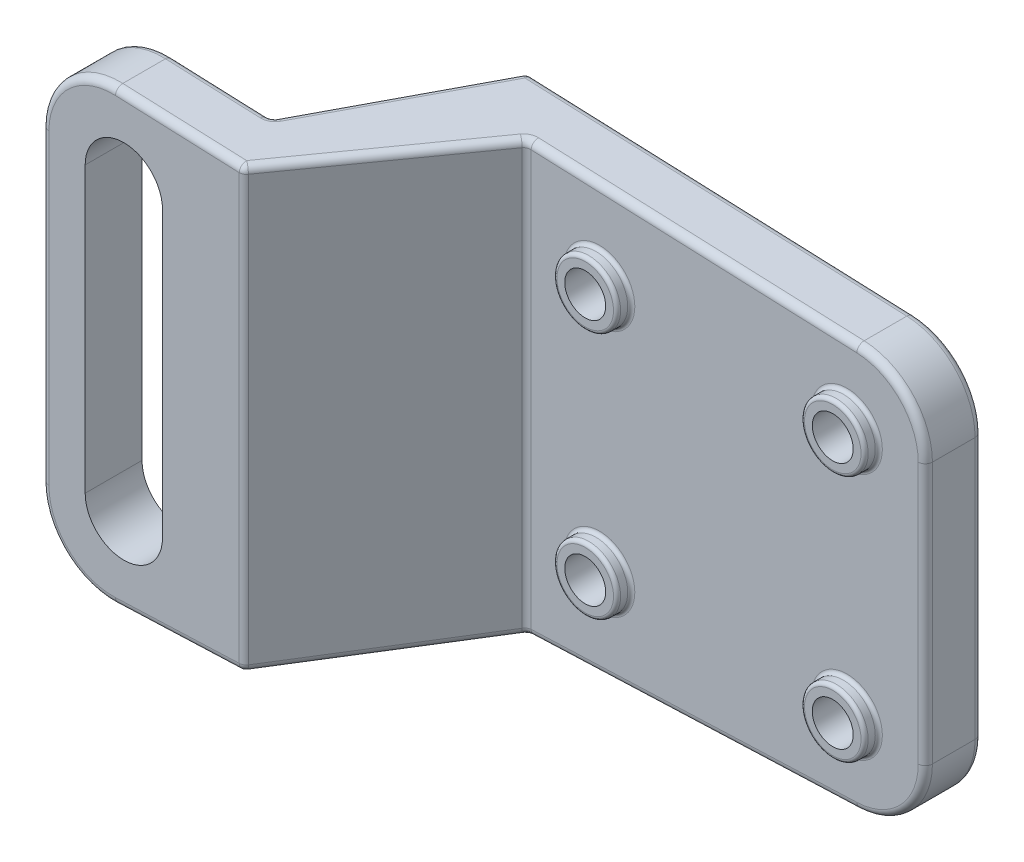
from build123d import *

# Parameters (mm, degrees)
SKETCH1_R           = 1.905
SKETCH1_R_2         = 1.9050000000000002
SKETCH1_R_3         = 1.9049999999999998
BOSS_EXTRUDE1_DEPTH = 3.175
FILLET1_R           = 3.96875
BOSS_EXTRUDE2_START = -1.5875
SKETCH2_R           = 1.9049999999999998
SKETCH2_R_2         = 1.143
SKETCH2_R_3         = 1.905
SKETCH2_R_4         = 1.1430000000000005
SKETCH2_R_5         = 1.9050000000000002
SKETCH2_R_6         = 1.1430000000000007
BOSS_EXTRUDE2_DEPTH = 1.5875
SKETCH4_R           = 1.778
SKETCH4_R_2         = 1.143
SKETCH4_R_3         = 1.7779999999999996
SKETCH4_R_4         = 1.1430000000000007
SKETCH4_R_5         = 1.1430000000000005
SKETCH4_R_6         = 1.1429999999999998
BOSS_EXTRUDE3_DEPTH = 0.79375
BOSS_EXTRUDE4_DEPTH = 9.525
CUT_EXTRUDE1_START  = 9.525
CUT_EXTRUDE1_DEPTH  = 9.525
CHAMFER1_SIZE       = 4.7625
CHAMFER1_SIZE_2     = 9.525
CHAMFER2_SIZE       = 9.525
CHAMFER2_SIZE_2     = 6.35
FILLET2_R           = 0.1984375
FILLET3_R           = 0.396875


with BuildPart() as part:
    # Sketch1 → Boss-Extrude1 (new body)
    with BuildSketch(Plane.XY):
        Polygon((-21.61209534413694, 5.788533000000001), (18.198446569224675, 4.201032999999999), (18.198446569224675, -18.023967), (-21.61209534413694, -19.611466999999998), align=None)
        Circle(SKETCH1_R, mode=Mode.SUBTRACT)
        with Locations((13.822933999999998, 0)):
            Circle(SKETCH1_R_2, mode=Mode.SUBTRACT)
        with Locations((13.822933999999998, -13.822933999999995)):
            Circle(SKETCH1_R, mode=Mode.SUBTRACT)
        with Locations((0, -13.822933999999998)):
            Circle(SKETCH1_R_3, mode=Mode.SUBTRACT)
        with BuildLine():
            Line((-14.873224000000008, 1.0260330000000009), (-14.873224000000008, -14.848967))
            ThreePointArc((-14.873224000000008, -14.848967), (-17.032224000000006, -17.007966999999994), (-19.191224000000002, -14.848967))
            Line((-19.191224000000002, -14.848967), (-19.191224000000002, 1.0260330000000009))
            ThreePointArc((-19.191224000000002, 1.0260330000000009), (-17.032224000000003, 3.1850329999999962), (-14.873224000000008, 1.0260330000000009))
        make_face(mode=Mode.SUBTRACT)
    extrude(amount=BOSS_EXTRUDE1_DEPTH)

    # Fillet1
    fillet1_edges = [part.edges().sort_by_distance(p)[0] for p in [
        (18.198446569224675, -18.023967, 1.5875),
        (-21.61209534413694, -19.611466999999998, 1.5875),
        (-21.61209534413694, 5.788533000000001, 1.5875),
        (18.198446569224675, 4.201032999999999, 1.5875),
    ]]
    fillet(fillet1_edges, radius=FILLET1_R)

    # Sketch2 → Boss-Extrude2 (add)
    # profile 1 of 4: a face of its own
    with BuildSketch(Plane.XY.offset(3.175).offset(BOSS_EXTRUDE2_START)):
        with Locations((0, -13.822933999999998)):
            Circle(SKETCH2_R)
        with Locations((0, -13.822933999999998)):
            Circle(SKETCH2_R_2, mode=Mode.SUBTRACT)
    # profile 2 of 4: a face of its own
    with BuildSketch(Plane.XY.offset(3.175).offset(BOSS_EXTRUDE2_START)):
        with Locations((13.822933999999998, -13.822933999999995)):
            Circle(SKETCH2_R_3)
        with Locations((13.822933999999998, -13.822933999999995)):
            Circle(SKETCH2_R_4, mode=Mode.SUBTRACT)
    # profile 3 of 4: a face of its own
    with BuildSketch(Plane.XY.offset(3.175).offset(BOSS_EXTRUDE2_START)):
        with Locations((13.822933999999998, 0)):
            Circle(SKETCH2_R_5)
        with Locations((13.822933999999998, 0)):
            Circle(SKETCH2_R_6, mode=Mode.SUBTRACT)
    # profile 4 of 4: a face of its own
    with BuildSketch(Plane.XY.offset(3.175).offset(BOSS_EXTRUDE2_START)):
        Circle(SKETCH2_R_3)
        Circle(SKETCH2_R_2, mode=Mode.SUBTRACT)
    extrude(amount=BOSS_EXTRUDE2_DEPTH)

    # Sketch4 → Boss-Extrude3 (add)
    # profile 1 of 4: a face of its own
    with BuildSketch(Plane.XY.offset(3.175)):
        Circle(SKETCH4_R)
        Circle(SKETCH4_R_2, mode=Mode.SUBTRACT)
    # profile 2 of 4: a face of its own
    with BuildSketch(Plane.XY.offset(3.175)):
        with Locations((13.822933999999998, 0)):
            Circle(SKETCH4_R_3)
        with Locations((13.822933999999998, 0)):
            Circle(SKETCH4_R_4, mode=Mode.SUBTRACT)
    # profile 3 of 4: a face of its own
    with BuildSketch(Plane.XY.offset(3.175)):
        with Locations((13.822933999999998, -13.822933999999995)):
            Circle(SKETCH4_R_3)
        with Locations((13.822933999999998, -13.822933999999995)):
            Circle(SKETCH4_R_5, mode=Mode.SUBTRACT)
    # profile 4 of 4: a face of its own
    with BuildSketch(Plane.XY.offset(3.175)):
        with Locations((0, -13.822933999999998)):
            Circle(SKETCH4_R)
        with Locations((0, -13.822933999999998)):
            Circle(SKETCH4_R_6, mode=Mode.SUBTRACT)
    extrude(amount=BOSS_EXTRUDE3_DEPTH)

    # Sketch5 → Boss-Extrude4 (add)
    with BuildSketch(Plane(origin=(0, 0, 3.175), x_dir=(-1, 0, 0), z_dir=(0, 0, -1))):
        with BuildLine():
            Line((4.026553430775324, 5.087285379502482), (4.026553430775327, -18.91021937950248))
            Line((4.026553430775327, -18.91021937950248), (17.485211666877564, -19.44690184909331))
            ThreePointArc((17.485211666877564, -19.44690184909331), (20.39319838847193, -18.342996140881855), (21.61209534413694, -15.48130349542505))
            Line((21.61209534413694, -15.48130349542505), (21.61209534413694, 1.658369495425054))
            ThreePointArc((21.61209534413694, 1.658369495425054), (20.393198388471934, 4.520062140881859), (17.485211666877564, 5.623967849093316))
            Line((17.485211666877564, 5.623967849093316), (4.026553430775324, 5.087285379502482))
        make_face()
        with BuildLine():
            Line((19.191224000000002, 1.0260330000000009), (19.191224000000002, -14.848967))
            ThreePointArc((19.191224000000002, -14.848967), (17.032224000000006, -17.007967), (14.873224000000008, -14.848967))
            Line((14.873224000000008, -14.848967), (14.873224000000008, 1.0260330000000009))
            ThreePointArc((14.873224000000008, 1.0260330000000009), (17.032224000000003, 3.185033), (19.191224000000002, 1.0260330000000009))
        make_face(mode=Mode.SUBTRACT)
    extrude(amount=-BOSS_EXTRUDE4_DEPTH)

    # Sketch6 → Cut-Extrude1 (cut)
    with BuildSketch(Plane.XY.offset(CUT_EXTRUDE1_START)):
        with BuildLine():
            Line((-7.201553430775324, 5.213892862288551), (-7.201553430775321, -19.036826862288546))
            Line((-7.201553430775321, -19.036826862288546), (-17.485211666877564, -19.44690184909331))
            ThreePointArc((-17.485211666877564, -19.44690184909331), (-20.393198388471934, -18.342996140881855), (-21.61209534413694, -15.48130349542505))
            Line((-21.61209534413694, -15.48130349542505), (-21.61209534413694, 1.658369495425054))
            ThreePointArc((-21.61209534413694, 1.658369495425054), (-20.393198388471934, 4.520062140881859), (-17.485211666877564, 5.623967849093316))
            Line((-17.485211666877564, 5.623967849093316), (-7.201553430775324, 5.213892862288551))
        make_face()
    extrude(amount=-CUT_EXTRUDE1_DEPTH, mode=Mode.SUBTRACT)

    # Chamfer1
    # the kernel refuses this chamfer: 9.525, 4.7625 mm, written as the material it adds along each edge
    with BuildSketch(Plane(origin=(-7.201553430775328, 29.882012885108104, 9.525), x_dir=(-0.9976223042390325, 0, 0.06891834360170876), z_dir=(1.5e-16, -1, 0))) as chamfer1_piece_1_section:
        Polygon((CHAMFER1_SIZE * 0.997622304239, CHAMFER1_SIZE * 0.0689183436017), (-CHAMFER1_SIZE_2 * 0.0689183436017, CHAMFER1_SIZE_2 * 0.997622304239), (0, 0), align=None)
    chamfer1_piece_1 = extrude(amount=73.5869597702162, mode=Mode.PRIVATE)
    chamfer1_piece_1 = split(chamfer1_piece_1, bisect_by=Plane(origin=(-8.238125396865149, 5.255227592163586, 6.340615679187515), z_dir=(-0.03984470608110253, -0.9992058843888534, 0)), keep=Keep.TOP, mode=Mode.PRIVATE)
    chamfer1_piece_1 = split(chamfer1_piece_1, bisect_by=Plane(origin=(-8.723289042893713, -6.911466999999917, 0), z_dir=(0, 0, 1)), keep=Keep.TOP, mode=Mode.PRIVATE)
    chamfer1_piece_1 = split(chamfer1_piece_1, bisect_by=Plane(origin=(-8.238125396865144, -19.078161592163585, 6.340615679187515), z_dir=(-0.039844706081102445, 0.9992058843888534, 0)), keep=Keep.TOP, mode=Mode.PRIVATE)
    add(chamfer1_piece_1)

    # Chamfer2
    # the kernel refuses this chamfer: 9.525, 6.35 mm, written as the material it takes off along each edge
    with BuildSketch(Plane(origin=(-4.02655343077532, 29.697985369397475, 12.7), x_dir=(0.021468383147227387, 0, -0.9997695277037822), z_dir=(-1.5e-16, -1, 0))) as chamfer2_piece_1_section:
        Polygon((CHAMFER2_SIZE * 0.999769527704, -CHAMFER2_SIZE * 0.0214683831472), (-CHAMFER2_SIZE_2 * 0.0214683831472, -CHAMFER2_SIZE_2 * 0.999769527704), (0, 0), align=None)
    chamfer2_piece_1 = extrude(amount=73.21890473879495, mode=Mode.PRIVATE)
    chamfer2_piece_1 = split(chamfer2_piece_1, bisect_by=Plane(origin=(-6.087745304988254, -6.911467000000003, 3.175), z_dir=(0, 0, 1)), keep=Keep.TOP, mode=Mode.PRIVATE)
    add(chamfer2_piece_1, mode=Mode.SUBTRACT)

    # Fillet2
    fillet2_edges = [part.edges().sort_by_distance(p)[0] for p in [
        (-1.778, -13.822933999999998, 3.96875),
        (-1.778, -13.822933999999998, 3.175),
        (12.044933999999998, -13.822933999999995, 3.96875),
        (12.044933999999998, -13.822933999999995, 3.175),
        (12.044933999999998, 2.2e-16, 3.96875),
        (12.044933999999998, 2.2e-16, 3.175),
        (-1.778, 2.2e-16, 3.96875),
        (-1.778, 2.2e-16, 3.175),
        (-1.905, 2.3e-16, 0),
        (11.917933999999999, 2.3e-16, 0),
        (11.917933999999999, -13.822933999999995, 0),
        (-1.9049999999999998, -13.822933999999998, 0),
        (-1.905, 2.3e-16, 1.5875),
        (11.917933999999999, 2.3e-16, 1.5875),
        (11.917933999999999, -13.822933999999995, 1.5875),
        (-1.9049999999999998, -13.822933999999998, 1.5875),
    ]]
    fillet(fillet2_edges, radius=FILLET2_R)

    # Fillet3
    fillet3_edges = [part.edges().sort_by_distance(p)[0] for p in [
        (5.180638407854362, -18.543069967780482, 3.175),
        (-13.930882548826972, 5.482234097083989, 12.7),
        (-20.393198388471934, 4.52006214088186, 12.7),
        (-21.61209534413694, -6.911466999999998, 12.7),
        (-20.39319838847193, -18.342996140881855, 12.7),
        (-4.0265534307753255, -6.911466999999998, 3.175),
        (3.593138407854365, -18.606373709173518, 0),
        (-7.201553430775323, -6.9114669999999965, 0),
        (-20.393198388471934, 4.52006214088186, 9.525),
        (-21.61209534413694, -6.911466999999998, 9.525),
        (-20.39319838847193, -18.342996140881855, 9.525),
        (-14.724632548826204, -19.33681996778047, 9.525),
        (-14.724632548826204, 5.5138859677804755, 9.525),
        (-11.964053430774843, -6.911466999999998, 9.525000000001425),
        (-9.58280343077635, 5.308848474378413, 4.762500000000869),
        (-9.582803430776348, -19.131782474378426, 4.76250000000087),
        (-13.930882548826972, -19.305168097083985, 12.7),
        (-7.201553430776219, -19.03682686228912, 7.937499999998967),
        (-10.37655343077638, -6.911466999999998, 12.70000000000127),
        (-7.201553430776219, 5.213892862289116, 7.937499999998966),
        (18.198446569224675, -6.911466999999998, 0),
        (3.593138407854365, 4.783439709173519, 0),
        (17.091389214681485, 3.1372412467252184, 0),
        (17.09138921468148, -16.960175246725218, 0),
        (18.198446569224675, -6.911466999999998, 3.175),
        (5.180638407854364, 4.720135967780484, 3.175),
        (17.091389214681485, 3.1372412467252184, 3.175),
        (17.09138921468148, -16.960175246725218, 3.175),
    ]]
    fillet(fillet3_edges, radius=FILLET3_R)


solid = part.part
